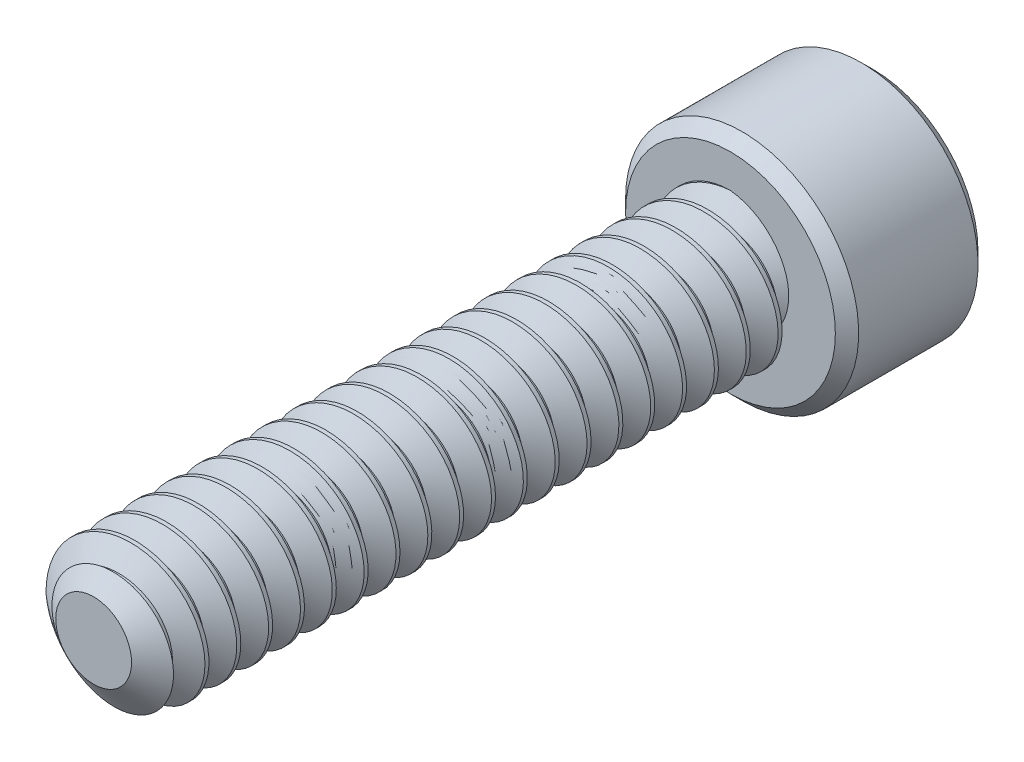
from build123d import *

# Parameters (mm, degrees)
SKETCH1_R          = 1.4224
EXTRUDE1_DEPTH     = 12.7
CUT_SWEEP1_PITCH   = 0.635
SKETCH6_R          = 2.3241
EXTRUDE2_DEPTH     = 2.8448
CUT_EXTRUDE1_DEPTH = 1.7859375
CHAMFER1_SIZE      = 0.23241


with BuildPart() as part:
    # Sketch1 → Extrude1 (new body)
    with BuildSketch(Plane.XY):
        Circle(SKETCH1_R)
    extrude(amount=-EXTRUDE1_DEPTH)

    # Cut-Sweep1: arcs per turn and ends read off the stored shape
    # Cut-Sweep1: the profile of Sketch3 profile screwed along a right-hand helix through 23 turns, 6 arcs to a turn; built about Z, then put on its axis
    cut_sweep1_z = Axis((0, 0, 0), (0, 0, 1))
    cut_sweep1_corners = [(1.4227, 0, -1.190798205), (1.009955401, 0, -0.9525), (1.009955401, 0, -0.873125), (1.4227, 0, -0.634826795)]
    with BuildLine(mode=Mode.PRIVATE) as cut_sweep1_profile:
        Line(cut_sweep1_corners[0], cut_sweep1_corners[1])
        Line(cut_sweep1_corners[1], cut_sweep1_corners[2])
        Line(cut_sweep1_corners[2], cut_sweep1_corners[3])
        Line(cut_sweep1_corners[3], cut_sweep1_corners[0])
    cut_sweep1_cap = Face(cut_sweep1_profile.wire())
    cut_sweep1_turn_angles = [0, 30, 60, 90, 120, 150, 180, 210, 240, 270, 300, 330, 360]
    cut_sweep1_turn_weights = [1, 0.8660254037844387, 1, 0.8660254037844387, 1, 0.8660254037844387, 1, 0.8660254037844387, 1, 0.8660254037844387, 1, 0.8660254037844387, 1]
    cut_sweep1_turn_rails = [Edge.make_bspline([Vector(p[0], p[1], 0).rotate(cut_sweep1_z, cut_sweep1_turn_angles[k]) / cut_sweep1_turn_weights[k] + Vector(0, 0, p[2] + CUT_SWEEP1_PITCH * cut_sweep1_turn_angles[k] / 360) for k in range(13)], [0, 0, 0, 1, 1, 2, 2, 3, 3, 4, 4, 5, 5, 6, 6, 6], 2, cut_sweep1_turn_weights) for p in cut_sweep1_corners]
    cut_sweep1_turn_sides = [Face.make_surface_from_curves(cut_sweep1_turn_rails[p[0]], cut_sweep1_turn_rails[p[1]]) for p in [(0, 1), (1, 2), (2, 3), (3, 0)]]
    cut_sweep1 = Plane(origin=(0, 0, 0), x_dir=(0, 1, 0), z_dir=(0, 0, -1)) * Solid(Shell([*[p.moved(Location((0, 0, CUT_SWEEP1_PITCH * i))) for i in range(23) for p in cut_sweep1_turn_sides], cut_sweep1_cap, cut_sweep1_cap.rotate(cut_sweep1_z, 8280).moved(Location((0, 0, CUT_SWEEP1_PITCH * 8280 / 360)))]))
    add(cut_sweep1, mode=Mode.SUBTRACT)

    # Sketch4 → Cut-Revolve1 (revolve, cut)
    with BuildSketch(Plane(origin=(0, 0, 0), x_dir=(0, 0, -1), z_dir=(1, 0, 0)), mode=Mode.PRIVATE) as cut_revolve1_sk:
        Polygon((0.466649532, 1.4224), (0, 0.755955401), (0, 1.4224), align=None)
    revolve(cut_revolve1_sk.sketch.rotate(Axis((0, 0, 0), (0, 0, -1)), 264.795368264), axis=Axis((0, 0, 0), (0, 0, -1)), mode=Mode.SUBTRACT)

    # Sketch6 → Extrude2 (add)
    with BuildSketch(Plane(origin=(0, 0, -12.7), x_dir=(-1, 0, 0), z_dir=(0, 0, -1))):
        Circle(SKETCH6_R)
    extrude(amount=EXTRUDE2_DEPTH)

    # Sketch7 → Cut-Extrude1 (cut)
    with BuildSketch(Plane(origin=(0, 0, -15.5448), x_dir=(-1, 0, 0), z_dir=(0, 0, -1))):
        Polygon((0, 1.374815329), (-1.190625, 0.687407664), (-1.190625, -0.687407664), (0, -1.374815329), (1.190625, -0.687407664), (1.190625, 0.687407664), align=None)
    extrude(amount=-CUT_EXTRUDE1_DEPTH, mode=Mode.SUBTRACT)

    # Cut-Extrude2 cone 1 section (through the dimple's axis) → Cut-Extrude2 (revolve, cut)
    with BuildSketch(Plane(origin=(0, 0, -15.5448), x_dir=(0, 1, 0), z_dir=(1, 0, 0))):
        Polygon((0, 0), (1.374815329, 0), (0, 1.374815329), align=None)
    revolve(axis=Axis((0, 0, -15.5448), (0, 0, 1)), mode=Mode.SUBTRACT)

    # Chamfer1
    chamfer1_edges = [part.edges().sort_by_distance(p)[0] for p in [
        (2.3241, 0, -12.7),
        (2.3241, 0, -15.5448),
    ]]
    chamfer(chamfer1_edges, length=CHAMFER1_SIZE)


solid = part.part
